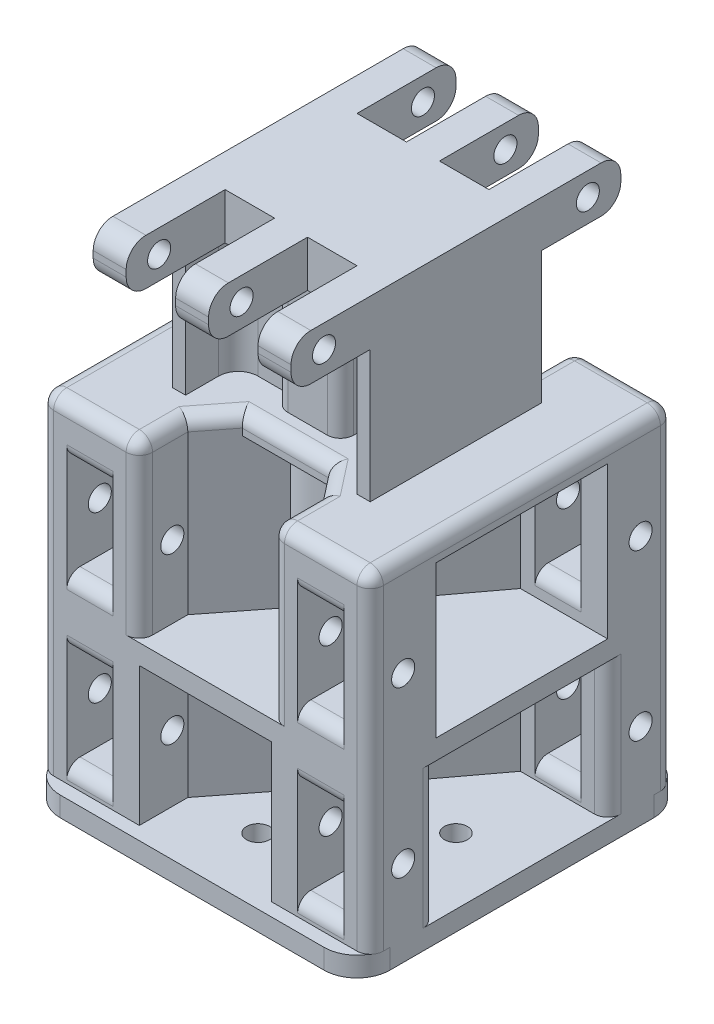
from build123d import *

# Parameters (mm, degrees)
BOSS_EXTRUDE1_DEPTH                        = 3
SKETCH2_W                                  = 15
SKETCH2_H                                  = 10
BOSS_EXTRUDE2_DEPTH                        = 50
SKETCH3_W                                  = 7
SKETCH3_H                                  = 15
CUT_EXTRUDE1_DEPTH                         = 10
SKETCH4_R                                  = 1.75
CUT_EXTRUDE2_DEPTH                         = 15
MIRROR4_AT_THE_SECOND_PLANE_COPY_1_DEPTH   = 3
MIRROR4_AT_THE_SECOND_PLANE_COPY_2_SKETC_W = 15
MIRROR4_AT_THE_SECOND_PLANE_COPY_2_SKETC_H = 10
MIRROR4_AT_THE_SECOND_PLANE_COPY_2_DEPTH   = 50
MIRROR4_AT_THE_SECOND_PLANE_COPY_3_SKETC_W = 7
MIRROR4_AT_THE_SECOND_PLANE_COPY_3_SKETC_H = 15
MIRROR4_AT_THE_SECOND_PLANE_COPY_3_DEPTH   = 10
MIRROR4_AT_THE_SECOND_PLANE_COPY_4_SKETC_R = 1.75
MIRROR4_AT_THE_SECOND_PLANE_COPY_4_DEPTH   = 15
BOSS_EXTRUDE3_DEPTH                        = 21
SKETCH6_R                                  = 1.75
CUT_EXTRUDE3_DEPTH                         = 21
BOSS_EXTRUDE4_DEPTH                        = 3
BOSS_EXTRUDE5_DEPTH                        = 23
BOSS_EXTRUDE6_DEPTH                        = 3
FILLET1_R                                  = 2
FILLET2_R                                  = 2
BOSS_EXTRUDE7_DEPTH                        = 20
SKETCH13_W                                 = 30
SKETCH13_H                                 = 50
BOSS_EXTRUDE8_DEPTH                        = 7
FILLET3_R                                  = 3
SKETCH14_W                                 = 7.5
SKETCH14_H                                 = 15
CUT_EXTRUDE4_DEPTH                         = 7
SKETCH15_R                                 = 1.75
CUT_EXTRUDE5_DEPTH                         = 93.870878105
FILLET4_R                                  = 3


with BuildPart() as part:
    # Sketch1 → Boss-Extrude1 (new body)
    with BuildSketch(Plane(origin=(0, 0, 0), x_dir=(1, 0, 0), z_dir=(0, 1, 0))):
        with BuildLine():
            Line((-20, 25), (20, 25))
            ThreePointArc((20, 25), (23.535533906, 23.535533906), (25, 20))
            Line((25, 20), (25, -20))
            ThreePointArc((25, -20), (23.535533906, -23.535533906), (20, -25))
            Line((20, -25), (-20, -25))
            ThreePointArc((-20, -25), (-23.535533906, -23.535533906), (-25, -20))
            Line((-25, -20), (-25, 20))
            ThreePointArc((-25, 20), (-23.535533906, 23.535533906), (-20, 25))
        make_face()
    boss_extrude1 = extrude(amount=BOSS_EXTRUDE1_DEPTH)

    # Sketch2 → Boss-Extrude2 (add)
    with BuildSketch(Plane(origin=(0, 3, 0), x_dir=(1, 0, 0), z_dir=(0, 1, 0))):
        with Locations((-17.5, 18)):
            Rectangle(SKETCH2_W, SKETCH2_H)
    boss_extrude2 = extrude(amount=BOSS_EXTRUDE2_DEPTH)

    # Sketch3 → Cut-Extrude1 (cut)
    with BuildSketch(Plane(origin=(0, 0, -23), x_dir=(-1, 0, 0), z_dir=(0, 0, -1))):
        with Locations((17.5, 38)):
            Rectangle(SKETCH3_W, SKETCH3_H)
        with Locations((17.5, 13)):
            Rectangle(SKETCH3_W, SKETCH3_H)
    cut_extrude1 = extrude(amount=-CUT_EXTRUDE1_DEPTH, mode=Mode.SUBTRACT)

    # Sketch4 → Cut-Extrude2 (cut)
    with BuildSketch(Plane.ZY.offset(25)):
        with Locations((-18, 37.999381084)):
            Circle(SKETCH4_R)
        with Locations((-18, 12.999381084)):
            Circle(SKETCH4_R)
    cut_extrude2 = extrude(amount=-CUT_EXTRUDE2_DEPTH, mode=Mode.SUBTRACT)

    # Mirror4 at the second plane: Boss-Extrude1, Boss-Extrude2, Cut-Extrude1, Cut-Extrude2 across plane
    add(boss_extrude1.mirror(Plane.XY))
    add(boss_extrude2.mirror(Plane.XY))
    add(cut_extrude1.mirror(Plane.XY), mode=Mode.SUBTRACT)
    add(cut_extrude2.mirror(Plane.XY), mode=Mode.SUBTRACT)



with BuildPart() as mirror4_1:
    # Mirror4: Boss-Extrude1, Boss-Extrude2 across plane
    add(boss_extrude1.mirror(Plane(origin=(0, 0, 0), x_dir=(0, 0, 1), z_dir=(1, 0, 0))))
    add(boss_extrude2.mirror(Plane(origin=(0, 0, 0), x_dir=(0, 0, 1), z_dir=(1, 0, 0))))

    # Mirror4 2: Cut-Extrude1, Cut-Extrude2 across plane
    add(cut_extrude1.mirror(Plane(origin=(0, 0, 0), x_dir=(0, 0, 1), z_dir=(1, 0, 0))), mode=Mode.SUBTRACT)
    add(cut_extrude2.mirror(Plane(origin=(0, 0, 0), x_dir=(0, 0, 1), z_dir=(1, 0, 0))), mode=Mode.SUBTRACT)


with BuildPart() as part_1:
    add(part.part)

    add(mirror4_1.part)  # Mirror4 at the second plane copy 1 merges Mirror4_1
    # Mirror4 at the second plane copy 1 sketc → Mirror4 at the second plane copy 1 (add)
    with BuildSketch(Plane(origin=(0, 0, 0), x_dir=(-1, 0, 0), z_dir=(0, 1, 0))):
        with BuildLine():
            Line((-20, 25), (20, 25))
            ThreePointArc((20, 25), (23.535533906, 23.535533906), (25, 20))
            Line((25, 20), (25, -20))
            ThreePointArc((25, -20), (23.535533906, -23.535533906), (20, -25))
            Line((20, -25), (-20, -25))
            ThreePointArc((-20, -25), (-23.535533906, -23.535533906), (-25, -20))
            Line((-25, -20), (-25, 20))
            ThreePointArc((-25, 20), (-23.535533906, 23.535533906), (-20, 25))
        make_face()
    extrude(amount=MIRROR4_AT_THE_SECOND_PLANE_COPY_1_DEPTH)

    # Mirror4 at the second plane copy 2 sketc → Mirror4 at the second plane copy 2 (add)
    with BuildSketch(Plane(origin=(0, 3, 0), x_dir=(-1, 0, 0), z_dir=(0, 1, 0))):
        with Locations((-17.5, 18)):
            Rectangle(MIRROR4_AT_THE_SECOND_PLANE_COPY_2_SKETC_W, MIRROR4_AT_THE_SECOND_PLANE_COPY_2_SKETC_H)
    extrude(amount=MIRROR4_AT_THE_SECOND_PLANE_COPY_2_DEPTH)

    # Mirror4 at the second plane copy 3 sketc → Mirror4 at the second plane copy 3 (cut)
    with BuildSketch(Plane.XY.offset(23)):
        with Locations((17.5, 38)):
            Rectangle(MIRROR4_AT_THE_SECOND_PLANE_COPY_3_SKETC_W, MIRROR4_AT_THE_SECOND_PLANE_COPY_3_SKETC_H)
        with Locations((17.5, 13)):
            Rectangle(MIRROR4_AT_THE_SECOND_PLANE_COPY_3_SKETC_W, MIRROR4_AT_THE_SECOND_PLANE_COPY_3_SKETC_H)
    extrude(amount=-MIRROR4_AT_THE_SECOND_PLANE_COPY_3_DEPTH, mode=Mode.SUBTRACT)

    # Mirror4 at the second plane copy 4 sketc → Mirror4 at the second plane copy 4 (cut)
    with BuildSketch(Plane(origin=(25, 0, 0), x_dir=(0, 0, -1), z_dir=(1, 0, 0))):
        with Locations((-18, 37.999381084)):
            Circle(MIRROR4_AT_THE_SECOND_PLANE_COPY_4_SKETC_R)
        with Locations((-18, 12.999381084)):
            Circle(MIRROR4_AT_THE_SECOND_PLANE_COPY_4_SKETC_R)
    extrude(amount=-MIRROR4_AT_THE_SECOND_PLANE_COPY_4_DEPTH, mode=Mode.SUBTRACT)

    # Sketch5 → Boss-Extrude3 (add)
    with BuildSketch(Plane(origin=(0, 3, 0), x_dir=(1, 0, 0), z_dir=(0, 1, 0))):
        with BuildLine():
            Line((-12.620037936, -14.13721587), (-5.601296161, -5.153636067))
            ThreePointArc((-5.601296161, -5.153636067), (-7.610331743, -0.131659235), (-5.776207442, 4.956804513))
            Line((-5.776207442, 4.956804513), (-12.617334455, 13.713047788))
            Line((-12.617334455, 13.713047788), (-10.253302195, 15.560032214))
            Line((-10.253302195, 15.560032214), (-3.412175181, 6.803788939))
            ThreePointArc((-3.412175181, 6.803788939), (0.006518541, 7.611467723), (3.42382384, 6.797934518))
            Line((3.42382384, 6.797934518), (10.256005675, 15.984200296))
            Line((10.256005675, 15.984200296), (12.620037936, 14.13721587))
            Line((12.620037936, 14.13721587), (5.767708857, 4.966690844))
            ThreePointArc((5.767708857, 4.966690844), (7.611467723, 0.006518541), (5.776207442, -4.956804513))
            Line((5.776207442, -4.956804513), (12.617334455, -13.713047788))
            Line((12.617334455, -13.713047788), (10.253302195, -15.560032214))
            Line((10.253302195, -15.560032214), (3.412175181, -6.803788939))
            ThreePointArc((3.412175181, -6.803788939), (0.132581652, -7.61031573), (-3.173114732, -6.918513301))
            Line((-3.173114732, -6.918513301), (-10.256005675, -15.984200296))
            Line((-10.256005675, -15.984200296), (-12.620037936, -14.13721587))
        make_face()
    extrude(amount=BOSS_EXTRUDE3_DEPTH)

    # Sketch6 → Cut-Extrude3 (cut)
    with BuildSketch(Plane(origin=(0, 3, 0), x_dir=(1, 0, 0), z_dir=(0, 1, 0))):
        with Locations(Location((-15, 0, 0), (0, 0, 270))):
            Circle(SKETCH6_R)
        with Locations(Location((0, 15, 0), (0, 0, 270))):
            Circle(SKETCH6_R)
        with Locations(Location((15, 0, 0), (0, 0, 270))):
            Circle(SKETCH6_R)
        with Locations(Location((0, -15, 0), (0, 0, 270))):
            Circle(SKETCH6_R)
    extrude(amount=-CUT_EXTRUDE3_DEPTH, mode=Mode.SUBTRACT)

    # Sketch7 → Boss-Extrude4 (add)
    with BuildSketch(Plane(origin=(0, 24, 0), x_dir=(1, 0, 0), z_dir=(0, 1, 0))):
        with BuildLine():
            Line((-23, -23), (23, -23))
            ThreePointArc((23, -23), (24.414213562, -22.414213562), (25, -21))
            Line((25, -21), (25, 21))
            ThreePointArc((25, 21), (24.414213562, 22.414213562), (23, 23))
            Line((23, 23), (-23, 23))
            ThreePointArc((-23, 23), (-24.414213562, 22.414213562), (-25, 21))
            Line((-25, 21), (-25, -21))
            ThreePointArc((-25, -21), (-24.414213562, -22.414213562), (-23, -23))
        make_face()
    extrude(amount=BOSS_EXTRUDE4_DEPTH)

    # Sketch8 → Boss-Extrude5 (add)
    with BuildSketch(Plane(origin=(0, 27, 0), x_dir=(1, 0, 0), z_dir=(0, 1, 0))):
        with BuildLine():
            Line((-12.620037936, -14.13721587), (-5.601296161, -5.153636067))
            ThreePointArc((-5.601296161, -5.153636067), (-7.610331743, -0.131659235), (-5.776207442, 4.956804513))
            Line((-5.776207442, 4.956804513), (-12.617334455, 13.713047788))
            Line((-12.617334455, 13.713047788), (-10.253302195, 15.560032214))
            Line((-10.253302195, 15.560032214), (-3.412175181, 6.803788939))
            ThreePointArc((-3.412175181, 6.803788939), (0.006518541, 7.611467723), (3.42382384, 6.797934518))
            Line((3.42382384, 6.797934518), (10.256005675, 15.984200296))
            Line((10.256005675, 15.984200296), (12.620037936, 14.13721587))
            Line((12.620037936, 14.13721587), (5.767708857, 4.966690844))
            ThreePointArc((5.767708857, 4.966690844), (7.611467723, 0.006518541), (5.776207442, -4.956804513))
            Line((5.776207442, -4.956804513), (12.617334455, -13.713047788))
            Line((12.617334455, -13.713047788), (10.253302195, -15.560032214))
            Line((10.253302195, -15.560032214), (3.412175181, -6.803788939))
            ThreePointArc((3.412175181, -6.803788939), (0.132581652, -7.61031573), (-3.173114732, -6.918513301))
            Line((-3.173114732, -6.918513301), (-10.256005675, -15.984200296))
            Line((-10.256005675, -15.984200296), (-12.620037936, -14.13721587))
        make_face()
    extrude(amount=BOSS_EXTRUDE5_DEPTH)

    # Sketch9 → Boss-Extrude6 (add)
    with BuildSketch(Plane(origin=(0, 50, 0), x_dir=(1, 0, 0), z_dir=(0, 1, 0))):
        with BuildLine():
            Line((10, 23), (10, 15.639985778))
            Line((10, 15.639985778), (6.71191192, 11.218960148))
            Line((6.71191192, 11.218960148), (-6.861684985, 11.218960148))
            Line((-6.861684985, 11.218960148), (-10, 15.23582019))
            Line((-10, 15.23582019), (-10, 23))
            Line((-10, 23), (-23, 23))
            ThreePointArc((-23, 23), (-24.414213562, 22.414213562), (-25, 21))
            Line((-25, 21), (-25, -21))
            ThreePointArc((-25, -21), (-24.414213562, -22.414213562), (-23, -23))
            Line((-23, -23), (-10, -23))
            Line((-10, -23), (-10, -15.656527974))
            Line((-10, -15.656527974), (-6.377394646, -11.019804565))
            Line((-6.377394646, -11.019804565), (6.706087591, -11.019804565))
            Line((6.706087591, -11.019804565), (10, -15.23582019))
            Line((10, -15.23582019), (10, -23))
            Line((10, -23), (23, -23))
            ThreePointArc((23, -23), (24.414213562, -22.414213562), (25, -21))
            Line((25, -21), (25, 21))
            ThreePointArc((25, 21), (24.414213562, 22.414213562), (23, 23))
            Line((23, 23), (10, 23))
        make_face()
    extrude(amount=BOSS_EXTRUDE6_DEPTH)

    # Fillet1
    # the kernel refuses this fillet: 2 mm, written as the material it takes off along each edge
    with BuildSketch(Plane(origin=(-25, 3, 23), x_dir=(0, 0, -1), z_dir=(0, 1, 0)), Plane(origin=(25, 3, 23), x_dir=(-1, 0, 0), z_dir=(0, 1, 0))) as fillet1_piece_1:
        with BuildLine():
            CenterArc((FILLET1_R, -FILLET1_R), FILLET1_R, 90, 90)
            Line((0, -FILLET1_R), (0, 0))
            Line((0, 0), (FILLET1_R, 0))
        make_face()
    extrude(amount=55, mode=Mode.SUBTRACT)
    with BuildSketch(Plane(origin=(-10, 27, 23), x_dir=(0, 0, -1), z_dir=(0, 1, 0)), Plane(origin=(10, 27, -23), x_dir=(0, 0, 1), z_dir=(0, 1, 0)), Plane(origin=(10, 58, 23), x_dir=(0, 0, -1), z_dir=(0, -1, 0)), Plane(origin=(-10, 58, -23), x_dir=(0, 0, 1), z_dir=(0, -1, 0))) as fillet1_piece_2:
        with BuildLine():
            CenterArc((FILLET1_R, FILLET1_R), FILLET1_R, 180, 90)
            Line((0, FILLET1_R), (0, 0))
            Line((0, 0), (FILLET1_R, 0))
        make_face()
    extrude(amount=31, mode=Mode.SUBTRACT)
    with BuildSketch(Plane(origin=(25, 3, -23), x_dir=(-1, 0, 0), z_dir=(0, 1, 0)), Plane(origin=(-25, 3, -23), x_dir=(0, 0, 1), z_dir=(0, 1, 0))) as fillet1_piece_3:
        with BuildLine():
            CenterArc((FILLET1_R, FILLET1_R), FILLET1_R, 180, 90)
            Line((0, FILLET1_R), (0, 0))
            Line((0, 0), (FILLET1_R, 0))
        make_face()
    extrude(amount=55, mode=Mode.SUBTRACT)
    with BuildSketch(Plane(origin=(-21, 30.5, 23), x_dir=(0, 0, -1), z_dir=(1, 0, 0)), Plane(origin=(-14, 45.5, 23), x_dir=(0, 0, -1), z_dir=(-1, 0, 0)), Plane(origin=(-21, 5.5, 23), x_dir=(0, 0, -1), z_dir=(1, 0, 0)), Plane(origin=(-14, 20.5, 23), x_dir=(0, 0, -1), z_dir=(-1, 0, 0)), Plane(origin=(21, 30.5, -23), x_dir=(0, 0, 1), z_dir=(-1, 0, 0)), Plane(origin=(14, 45.5, -23), x_dir=(0, 0, 1), z_dir=(1, 0, 0)), Plane(origin=(21, 30.5, -13), x_dir=(0, -1, 0), z_dir=(-1, 0, 0)), Plane(origin=(14, 45.5, -13), x_dir=(0, 1, 0), z_dir=(1, 0, 0)), Plane(origin=(21, 5.5, -23), x_dir=(0, 0, 1), z_dir=(-1, 0, 0)), Plane(origin=(14, 20.5, -23), x_dir=(0, 0, 1), z_dir=(1, 0, 0)), Plane(origin=(21, 5.5, -13), x_dir=(0, -1, 0), z_dir=(-1, 0, 0)), Plane(origin=(14, 20.5, -13), x_dir=(0, 1, 0), z_dir=(1, 0, 0)), Plane(origin=(14, 45.5, 13), x_dir=(0, 0, 1), z_dir=(1, 0, 0)), Plane(origin=(14, 20.5, 13), x_dir=(0, 0, 1), z_dir=(1, 0, 0)), Plane(origin=(-14, 45.5, -13), x_dir=(0, 0, -1), z_dir=(-1, 0, 0)), Plane(origin=(-21, 30.5, -13), x_dir=(0, 0, -1), z_dir=(1, 0, 0)), Plane(origin=(-14, 20.5, -13), x_dir=(0, 0, -1), z_dir=(-1, 0, 0))) as fillet1_piece_4:
        with BuildLine():
            CenterArc((FILLET1_R, -FILLET1_R), FILLET1_R, 90, 90)
            Line((0, -FILLET1_R), (0, 0))
            Line((0, 0), (FILLET1_R, 0))
        make_face()
    extrude(amount=7, mode=Mode.SUBTRACT)
    with BuildSketch(Plane(origin=(-21, 30.5, 13), x_dir=(0, 0, 1), z_dir=(1, 0, 0)), Plane(origin=(-14, 45.5, 13), x_dir=(0, 0, 1), z_dir=(-1, 0, 0)), Plane(origin=(-21, 5.5, 13), x_dir=(0, 0, 1), z_dir=(1, 0, 0)), Plane(origin=(-14, 20.5, 13), x_dir=(0, 0, 1), z_dir=(-1, 0, 0)), Plane(origin=(21, 30.5, 13), x_dir=(0, -1, 0), z_dir=(-1, 0, 0)), Plane(origin=(21, 30.5, 23), x_dir=(0, 0, -1), z_dir=(-1, 0, 0)), Plane(origin=(14, 45.5, 23), x_dir=(0, 0, -1), z_dir=(1, 0, 0)), Plane(origin=(21, 5.5, 13), x_dir=(0, -1, 0), z_dir=(-1, 0, 0)), Plane(origin=(21, 5.5, 23), x_dir=(0, 0, -1), z_dir=(-1, 0, 0)), Plane(origin=(14, 20.5, 23), x_dir=(0, 0, -1), z_dir=(1, 0, 0)), Plane(origin=(-21, 30.5, -23), x_dir=(0, 0, 1), z_dir=(1, 0, 0)), Plane(origin=(-14, 45.5, -23), x_dir=(0, 0, 1), z_dir=(-1, 0, 0)), Plane(origin=(-21, 5.5, -13), x_dir=(0, -1, 0), z_dir=(1, 0, 0)), Plane(origin=(-21, 5.5, -23), x_dir=(0, 0, 1), z_dir=(1, 0, 0)), Plane(origin=(-14, 20.5, -23), x_dir=(0, 0, 1), z_dir=(-1, 0, 0))) as fillet1_piece_5:
        with BuildLine():
            CenterArc((FILLET1_R, FILLET1_R), FILLET1_R, 180, 90)
            Line((0, FILLET1_R), (0, 0))
            Line((0, 0), (FILLET1_R, 0))
        make_face()
    extrude(amount=7, mode=Mode.SUBTRACT)
    with BuildSketch(Plane(origin=(-25, 3, 13), x_dir=(0, 0, 1), z_dir=(0, 1, 0)), Plane(origin=(25, 3, 13), x_dir=(-1, 0, 0), z_dir=(0, 1, 0))) as fillet1_piece_6:
        with BuildLine():
            CenterArc((FILLET1_R, FILLET1_R), FILLET1_R, 180, 90)
            Line((0, FILLET1_R), (0, 0))
            Line((0, 0), (FILLET1_R, 0))
        make_face()
    extrude(amount=21, mode=Mode.SUBTRACT)
    with BuildSketch(Plane(origin=(-25, 3, -13), x_dir=(0, 0, -1), z_dir=(0, 1, 0)), Plane(origin=(25, 3, -13), x_dir=(-1, 0, 0), z_dir=(0, 1, 0))) as fillet1_piece_7:
        with BuildLine():
            CenterArc((FILLET1_R, -FILLET1_R), FILLET1_R, 90, 90)
            Line((0, -FILLET1_R), (0, 0))
            Line((0, 0), (FILLET1_R, 0))
        make_face()
    extrude(amount=21, mode=Mode.SUBTRACT)

    # Fillet2
    fillet2_edges = [part_1.edges().sort_by_distance(p)[0] for p in [
        (10, 53, 18.117910095),
        (10, 53, -18.319992889),
        (-10, 53, 18.328263987),
        (-10, 53, -18.117910095),
        (-8.188697323, 53, 13.338166269),
        (0.164346472, 53, 11.019804565),
        (8.353043795, 53, 13.127812377),
        (8.35595596, 53, -13.429472963),
        (-0.074886533, 53, -11.218960148),
        (-8.430842493, 53, -13.227390169),
        (-17.5, 53, 23),
        (17.5, 53, 23),
        (-17.5, 53, -23),
        (-25, 53, 0),
        (25, 53, 0),
        (-24.414213562, 53, -22.414213562),
        (-10.585786438, 53, -22.414213562),
        (10.585786438, 53, -22.414213562),
        (10.585786438, 53, 22.414213562),
        (-24.414213562, 53, 22.414213562),
        (24.414213562, 53, -22.414213562),
        (24.414213562, 53, 22.414213562),
        (-10.585786438, 53, 22.414213562),
    ]]
    fillet(fillet2_edges, radius=FILLET2_R)

    # Sketch10 → Boss-Extrude7 (add)
    with BuildSketch(Plane(origin=(0, 53, 0), x_dir=(1, 0, 0), z_dir=(0, 1, 0))):
        with BuildLine():
            Line((-13, 5), (-4.999955026, 5))
            Line((-4.999955026, 5), (-4.999955026, 5.499820103))
            ThreePointArc((-4.999955026, 5.499820103), (-4.414168588, 6.914033666), (-2.999955026, 7.499820103))
            Line((-2.999955026, 7.499820103), (3.000000008, 7.499820103))
            ThreePointArc((3.000000008, 7.499820103), (4.414149966, 6.914097267), (5, 5.5))
            Line((5, 5.5), (4.999955026, 5))
            Line((4.999955026, 5), (13, 5))
            Line((13, 5), (13, 13))
            Line((13, 13), (15, 13))
            Line((15, 13), (15, 2.169602618))
            Line((15, 2.169602618), (15, -3))
            Line((15, -3), (15, -13))
            Line((15, -13), (13, -13))
            Line((13, -13), (13, -5))
            Line((13, -5), (4.999955026, -5))
            Line((4.999955026, -5), (4.999955026, -5.5))
            ThreePointArc((4.999955026, -5.5), (4.414168588, -6.914213562), (2.999955026, -7.5))
            Line((2.999955026, -7.5), (-2.999955026, -7.5))
            ThreePointArc((-2.999955026, -7.5), (-4.414168588, -6.914213562), (-4.999955026, -5.5))
            Line((-4.999955026, -5.5), (-4.999955026, -5))
            Line((-4.999955026, -5), (-13, -5))
            Line((-13, -5), (-13, -13))
            Line((-13, -13), (-15, -13))
            Line((-15, -13), (-15, -3))
            Line((-15, -3), (-15, 3))
            Line((-15, 3), (-15, 13))
            Line((-15, 13), (-13, 13))
            Line((-13, 13), (-13, 5))
        make_face()
    extrude(amount=BOSS_EXTRUDE7_DEPTH)

    # Sketch13 → Boss-Extrude8 (add)
    with BuildSketch(Plane(origin=(0, 73, 0), x_dir=(1, 0, 0), z_dir=(0, 1, 0))):
        Rectangle(SKETCH13_W, SKETCH13_H)
    extrude(amount=BOSS_EXTRUDE8_DEPTH)

    # Fillet3
    fillet3_edges = [part_1.edges().sort_by_distance(p)[0] for p in [
        (0, 73, -25),
        (0, 73, 25),
        (0, 80, -25),
        (0, 80, 25),
    ]]
    fillet(fillet3_edges, radius=FILLET3_R)

    # Sketch14 → Cut-Extrude4 (cut)
    with BuildSketch(Plane(origin=(0, 80, 0), x_dir=(1, 0, 0), z_dir=(0, 1, 0))):
        with Locations((-6.25, 17.5)):
            Rectangle(SKETCH14_W, SKETCH14_H)
        with Locations((6.25, 17.5)):
            Rectangle(SKETCH14_W, SKETCH14_H)
        with Locations((-6.25, -17.5)):
            Rectangle(SKETCH14_W, SKETCH14_H)
        with Locations((6.25, -17.5)):
            Rectangle(SKETCH14_W, SKETCH14_H)
    extrude(amount=-CUT_EXTRUDE4_DEPTH, mode=Mode.SUBTRACT)

    # Sketch15 → Cut-Extrude5 (cut, through all)
    with BuildSketch(Plane.ZY.offset(15)):
        with Locations((-20, 76.5)):
            Circle(SKETCH15_R)
        with Locations((20, 76.5)):
            Circle(SKETCH15_R)
    extrude(amount=-CUT_EXTRUDE5_DEPTH, mode=Mode.SUBTRACT)

    # Fillet4
    fillet4_edges = [part_1.edges().sort_by_distance(p)[0] for p in [
        (-13, 63, 5),
        (13, 63, 5),
        (13, 63, -5),
        (-13, 63, -5),
    ]]
    fillet(fillet4_edges, radius=FILLET4_R)


solid = part_1.part
